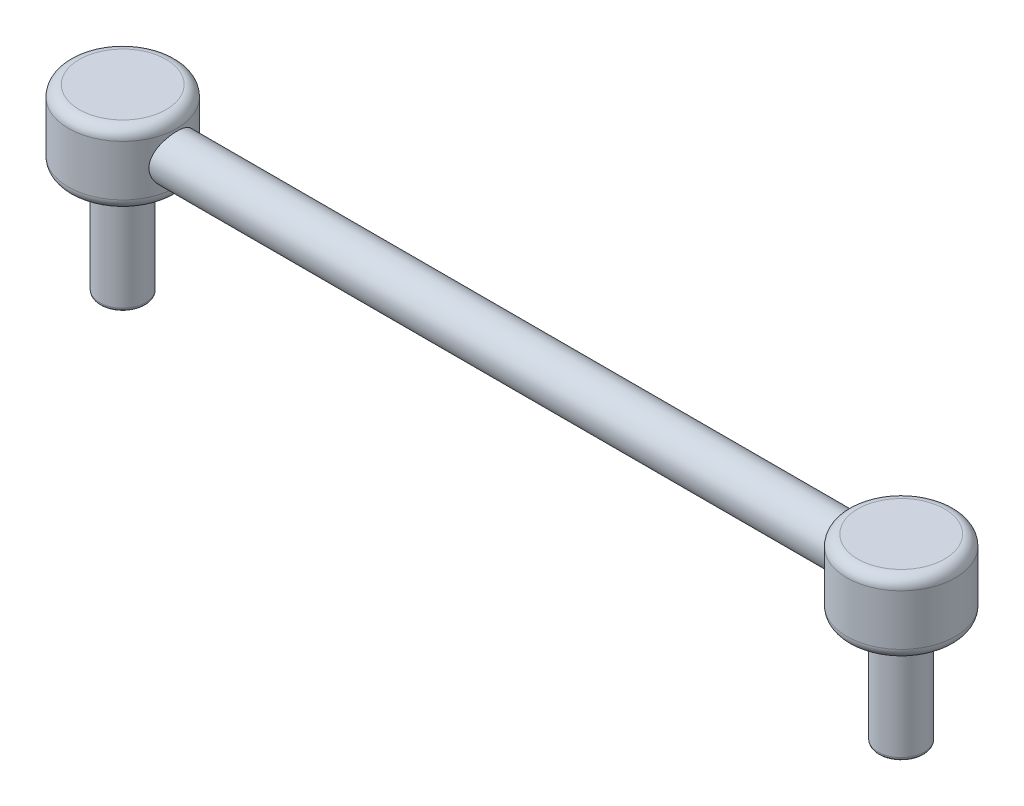
from build123d import *

# Parameters (mm, degrees)
SKETCH1_R           = 6.35
BOSS_EXTRUDE1_DEPTH = 30
SKETCH2_R           = 15
BOSS_EXTRUDE2_DEPTH = 20
SKETCH4_R           = 6.35
BOSS_EXTRUDE3_DEPTH = 30
SKETCH5_R           = 15
BOSS_EXTRUDE4_DEPTH = 20
SKETCH6_R           = 6.35
BOSS_EXTRUDE5_DEPTH = 215
FILLET1_R           = 3
FILLET2_R           = 1


with BuildPart() as part:
    # Sketch1 → Boss-Extrude1 (new body)
    with BuildSketch(Plane(origin=(0, 0, 0), x_dir=(1, 0, 0), z_dir=(0, 1, 0))):
        Circle(SKETCH1_R)
    extrude(amount=-BOSS_EXTRUDE1_DEPTH)

    # Sketch2 → Boss-Extrude2 (add)
    with BuildSketch(Plane(origin=(0, 0, 0), x_dir=(1, 0, 0), z_dir=(0, 1, 0))):
        Circle(SKETCH2_R)
    extrude(amount=BOSS_EXTRUDE2_DEPTH)



with BuildPart() as body_2:
    # Sketch4 → Boss-Extrude3 (new body)
    with BuildSketch(Plane(origin=(0, 0, 0), x_dir=(1, 0, 0), z_dir=(0, 1, 0))):
        with Locations((215, 0)):
            Circle(SKETCH4_R)
    extrude(amount=-BOSS_EXTRUDE3_DEPTH)

    # Sketch5 → Boss-Extrude4 (add)
    with BuildSketch(Plane(origin=(0, 0, 0), x_dir=(1, 0, 0), z_dir=(0, 1, 0))):
        with Locations((215, 0)):
            Circle(SKETCH5_R)
    extrude(amount=BOSS_EXTRUDE4_DEPTH)


with BuildPart() as part_1:
    add(part.part)

    add(body_2.part)  # Boss-Extrude5 merges body 2
    # Sketch6 → Boss-Extrude5 (add)
    with BuildSketch(Plane(origin=(0, 0, 0), x_dir=(0, 0, -1), z_dir=(1, 0, 0))):
        with Locations((0, 10)):
            Circle(SKETCH6_R)
    extrude(amount=BOSS_EXTRUDE5_DEPTH)

    # Fillet1
    fillet1_edges = [part_1.edges().sort_by_distance(p)[0] for p in [
        (200, 0, 0),
        (-15, 0, 0),
        (-15, 20, 0),
        (200, 20, 0),
    ]]
    fillet(fillet1_edges, radius=FILLET1_R)

    # Fillet2
    fillet2_edges = [part_1.edges().sort_by_distance(p)[0] for p in [
        (208.65, -30, 0),
        (-6.35, -30, 0),
    ]]
    fillet(fillet2_edges, radius=FILLET2_R)


solid = part_1.part
